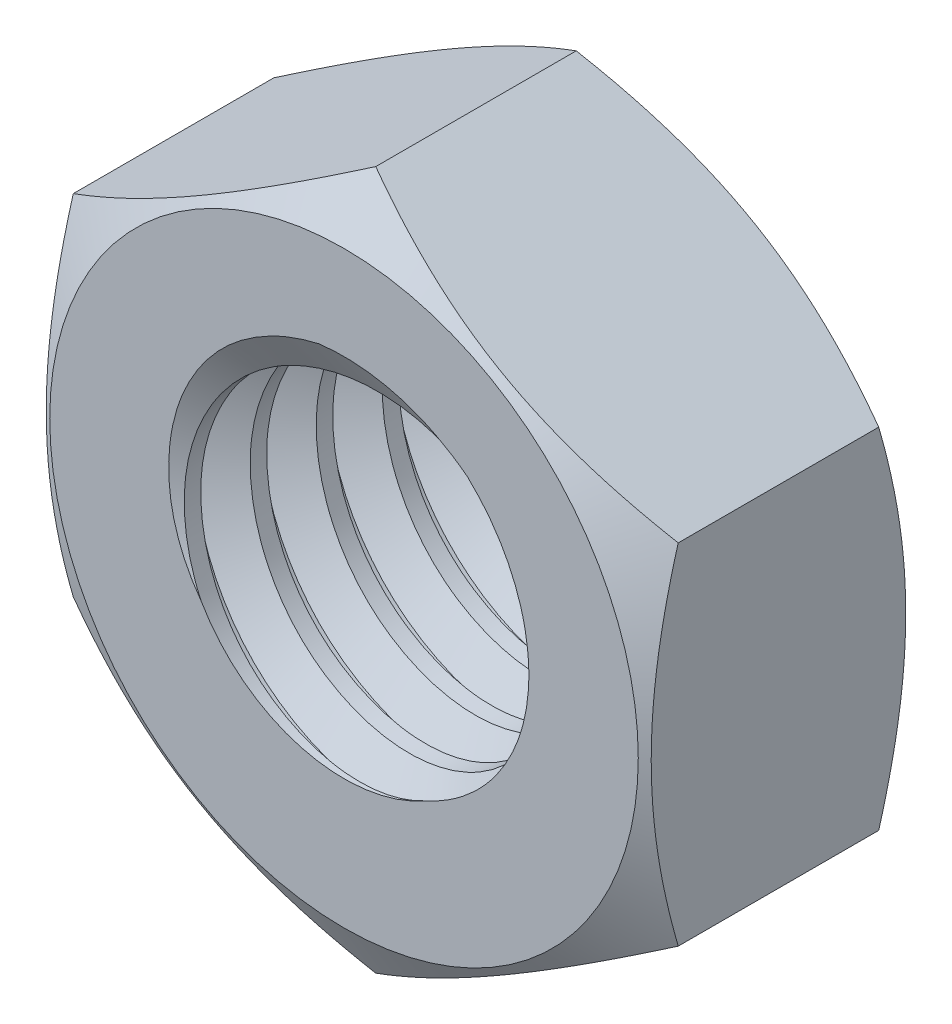
from build123d import *

# Parameters (mm, degrees)
CROQUIS1_R              = 1.5
SALIENTE_EXTRUIR1_DEPTH = 1.2
ROSCA1_PITCH            = 0.6


with BuildPart() as part:
    # Croquis1 → Saliente-Extruir1 (new, symmetric)
    with BuildSketch(Plane.XY):
        Polygon((0, 3.175426481), (-2.75, 1.58771324), (-2.75, -1.58771324), (0, -3.175426481), (2.75, -1.58771324), (2.75, 1.58771324), align=None)
        Circle(CROQUIS1_R, mode=Mode.SUBTRACT)
    extrude(amount=SALIENTE_EXTRUIR1_DEPTH, both=True)

    # Croquis2 → Cortar-Revolución1 (revolve, cut)
    with BuildSketch(Plane(origin=(0, 0, 0), x_dir=(0, 0, -1), z_dir=(1, 0, 0)), mode=Mode.PRIVATE) as cortar_revoluci_n1_sk:
        Polygon((0.911324865, 3.175426481), (1.2, 2.675426481), (1.2, 3.175426481), align=None)
    cortar_revoluci_n1 = revolve(cortar_revoluci_n1_sk.sketch.rotate(Axis((0, 0, 1.2), (0, 0, -1)), 90), axis=Axis((0, 0, 1.2), (0, 0, -1)), mode=Mode.SUBTRACT)

    # Simetría1: Cortar-Revolución1 across plane
    add(cortar_revoluci_n1.mirror(Plane.XY), mode=Mode.SUBTRACT)

    # Rosca1: the profile of Perfil de rosca3 profile screwed along a right-hand helix of 6.666667 turns, 6 arcs to a turn; built about Z, then put on its axis
    rosca1_z = Axis((0, 0, 0), (0, 0, 1))
    rosca1_corners = [(1.4997, 0, -0.000173205), (1.824759525, 0, 0.187499999), (1.824759525, 0, 0.262499999), (1.4997, 0, 0.450173203)]
    with BuildLine(mode=Mode.PRIVATE) as rosca1_profile:
        Line(rosca1_corners[0], rosca1_corners[1])
        Line(rosca1_corners[1], rosca1_corners[2])
        Line(rosca1_corners[2], rosca1_corners[3])
        Line(rosca1_corners[3], rosca1_corners[0])
    rosca1_cap = Face(rosca1_profile.wire())
    rosca1_turn_angles = [0, 30, 60, 90, 120, 150, 180, 210, 240, 270, 300, 330, 360]
    rosca1_turn_weights = [1, 0.8660254037844387, 1, 0.8660254037844387, 1, 0.8660254037844387, 1, 0.8660254037844387, 1, 0.8660254037844387, 1, 0.8660254037844387, 1]
    rosca1_turn_rails = [Edge.make_bspline([Vector(p[0], p[1], 0).rotate(rosca1_z, rosca1_turn_angles[k]) / rosca1_turn_weights[k] + Vector(0, 0, p[2] + ROSCA1_PITCH * rosca1_turn_angles[k] / 360) for k in range(13)], [0, 0, 0, 1, 1, 2, 2, 3, 3, 4, 4, 5, 5, 6, 6, 6], 2, rosca1_turn_weights) for p in rosca1_corners]
    rosca1_turn_sides = [Face.make_surface_from_curves(rosca1_turn_rails[p[0]], rosca1_turn_rails[p[1]]) for p in [(0, 1), (1, 2), (2, 3), (3, 0)]]
    rosca1_last_angles = [2160, 2190, 2220, 2250, 2280, 2310, 2340, 2370, 2400]
    rosca1_last_weights = [1, 0.8660254037844387, 1, 0.8660254037844387, 1, 0.8660254037844387, 1, 0.8660254037844387, 1]
    rosca1_last_rails = [Edge.make_bspline([Vector(p[0], p[1], 0).rotate(rosca1_z, rosca1_last_angles[k]) / rosca1_last_weights[k] + Vector(0, 0, p[2] + ROSCA1_PITCH * rosca1_last_angles[k] / 360) for k in range(9)], [0, 0, 0, 1, 1, 2, 2, 3, 3, 4, 4, 4], 2, rosca1_last_weights) for p in rosca1_corners]
    rosca1_last_sides = [Face.make_surface_from_curves(rosca1_last_rails[p[0]], rosca1_last_rails[p[1]]) for p in [(0, 1), (1, 2), (2, 3), (3, 0)]]
    rosca1 = Plane(origin=(0, 0, 2.2), x_dir=(-1, 0, 0), z_dir=(0, 0, -1)) * Solid(Shell([*[p.moved(Location((0, 0, ROSCA1_PITCH * i))) for i in range(6) for p in rosca1_turn_sides], *rosca1_last_sides, rosca1_cap, rosca1_cap.rotate(rosca1_z, 2400).moved(Location((0, 0, ROSCA1_PITCH * 2400 / 360)))]))
    add(rosca1, mode=Mode.SUBTRACT)


solid = part.part
